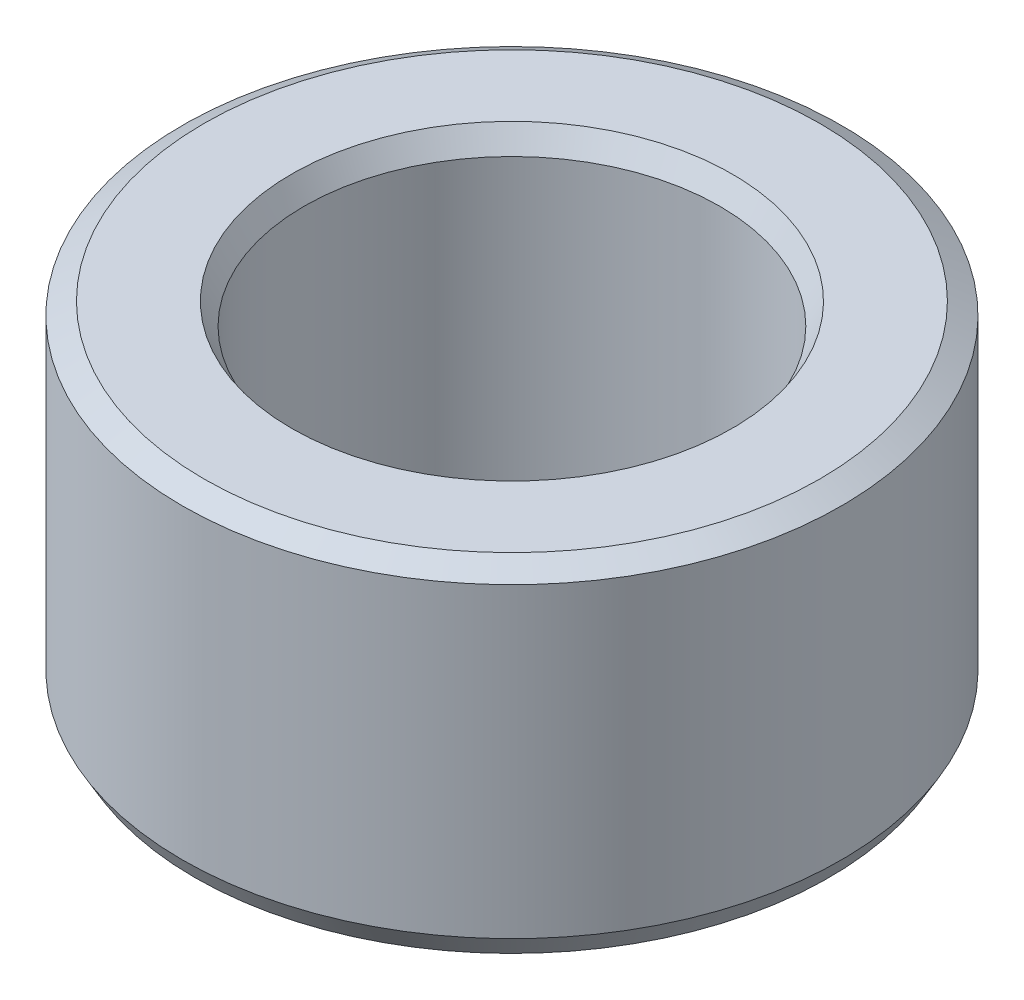
from build123d import *
from OCP.BRepFilletAPI import BRepFilletAPI_MakeChamfer

# Parameters (mm, degrees)
SKETCH1_R           = 20
BOSS_EXTRUDE1_DEPTH = 20.673248093
SKETCH2_R           = 12.612349595
CUT_EXTRUDE1_DEPTH  = 36.034028982
CHAMFER1_SIZE       = 0.757656537
CHAMFER1_SIZE2      = 1.312299616


with BuildPart() as part:
    # Sketch1 → Boss-Extrude1 (new body)
    with BuildSketch(Plane(origin=(0, 0, 0), x_dir=(1, 0, 0), z_dir=(0, 1, 0))):
        Circle(SKETCH1_R)
    extrude(amount=BOSS_EXTRUDE1_DEPTH)

    # Sketch2 → Cut-Extrude1 (cut, through all)
    with BuildSketch(Plane(origin=(0, 0, 0), x_dir=(1, 0, 0), z_dir=(0, 1, 0))):
        Circle(SKETCH2_R)
    extrude(amount=CUT_EXTRUDE1_DEPTH, mode=Mode.SUBTRACT)

    # Chamfer1: one chamfer whose edges measure the first distance from different faces: ONE call of the kernel's chamfer builder (chamfer() names one face for all edges)
    chamfer1_edges_1 = [part.edges().sort_by_distance(p)[0] for p in [
        (-12.612349595, 20.673248093, 0),
    ]]
    chamfer1_side_1 = [part.faces().sort_by_distance(p)[0] for p in [
        (-19.434314575, 20.673248093, 0),
    ]]
    chamfer1_edges_2 = [part.edges().sort_by_distance(p)[0] for p in [
        (-12.612349595, 0, 0),
    ]]
    chamfer1_side_2 = [part.faces().sort_by_distance(p)[0] for p in [
        (-12.612349595, 10.336624046, 0),
    ]]
    chamfer1_edges_3 = [part.edges().sort_by_distance(p)[0] for p in [
        (-20, 0, 0),
    ]]
    chamfer1_side_3 = [part.faces().sort_by_distance(p)[0] for p in [
        (-19.434314575, 0, 0),
    ]]
    chamfer1_edges_4 = [part.edges().sort_by_distance(p)[0] for p in [
        (-20, 20.673248093, 0),
    ]]
    chamfer1_side_4 = [part.faces().sort_by_distance(p)[0] for p in [
        (-20, 10.336624046, 0),
    ]]
    chamfer1 = BRepFilletAPI_MakeChamfer(part.part.solid().wrapped)
    for e in chamfer1_edges_1:
        chamfer1.Add(CHAMFER1_SIZE, CHAMFER1_SIZE2, e.wrapped, chamfer1_side_1[0].wrapped)  # the first distance lies on this face
    for e in chamfer1_edges_2:
        chamfer1.Add(CHAMFER1_SIZE, CHAMFER1_SIZE2, e.wrapped, chamfer1_side_2[0].wrapped)  # the first distance lies on this face
    for e in chamfer1_edges_3:
        chamfer1.Add(CHAMFER1_SIZE, CHAMFER1_SIZE2, e.wrapped, chamfer1_side_3[0].wrapped)  # the first distance lies on this face
    for e in chamfer1_edges_4:
        chamfer1.Add(CHAMFER1_SIZE, CHAMFER1_SIZE2, e.wrapped, chamfer1_side_4[0].wrapped)  # the first distance lies on this face
    add(Compound.cast(chamfer1.Shape()), mode=Mode.REPLACE)


solid = part.part
